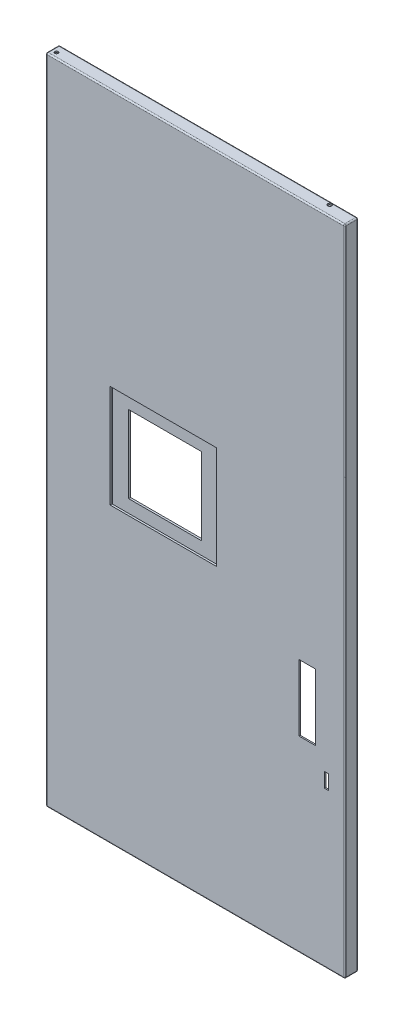
from build123d import *

# Parameters (mm, degrees)
SKETCH1_W                = 451
SKETCH1_H                = 20
BOSS_EXTRUDE1_DEPTH      = 666
SKETCH2_W                = 429
SKETCH2_H                = 644
CUT_EXTRUDE1_DEPTH       = 18
SKETCH3_W                = 429
SKETCH3_H                = 16
CUT_EXTRUDE2_DEPTH       = 9
SKETCH4_W                = 16
SKETCH4_H                = 653
CUT_EXTRUDE3_DEPTH       = 9
SKETCH5_W                = 438
SKETCH5_H                = 16
CUT_EXTRUDE4_DEPTH       = 9
SKETCH6_W                = 16
SKETCH6_H                = 662
CUT_EXTRUDE5_DEPTH       = 9
FILLET1_R                = 2
FILLET2_R                = 2
FILLET3_R                = 2
FILLET4_R                = 2
SKETCH16_R               = 3
CUT_EXTRUDE15_DEPTH      = 2
SKETCH23_W               = 451
SKETCH23_H               = 20
BOSS_EXTRUDE5_DEPTH      = 330
SKETCH25_W               = 429
SKETCH25_H               = 319
CUT_EXTRUDE19_DEPTH      = 18
SKETCH26_W               = 16
SKETCH26_H               = 319
CUT_EXTRUDE20_DEPTH      = 9
SKETCH27_W               = 438
SKETCH27_H               = 16
CUT_EXTRUDE21_DEPTH      = 9
SKETCH28_W               = 16
SKETCH28_H               = 328
CUT_EXTRUDE22_DEPTH      = 9
FILLET5_R                = 2
CUT_EXTRUDE24_DEPTH      = 1011.532161784
CUT_EXTRUDE24_DEPTH_BACK = 1011.532161784
SKETCH30_R               = 2.5
SKETCH31_R               = 3
CUT_EXTRUDE25_DEPTH      = 2
SKETCH29_R               = 3
CUT_EXTRUDE26_DEPTH      = 2
SKETCH32_W               = 25
SKETCH32_H               = 100
SKETCH32_W_2             = 6
SKETCH32_H_2             = 22
CUT_EXTRUDE27_DEPTH      = 2
SKETCH34_W               = 166
SKETCH34_H               = 276
BOSS_EXTRUDE6_DEPTH      = 6
CUT_EXTRUDE28_DEPTH      = 3
SKETCH35_R               = 4
CUT_EXTRUDE29_DEPTH      = 1011.625672542
SKETCH36_W               = 110
SKETCH36_H               = 232.68198512
CUT_EXTRUDE30_DEPTH      = 1011.625672542
SKETCH37_W               = 242.184541093
SKETCH37_H               = 239.855843582
SKETCH37_W_2             = 227.10839581
SKETCH37_H_2             = 174.911365708
BOSS_EXTRUDE7_DEPTH      = 2
SKETCH39_W               = 167.145869321
SKETCH39_H               = 47.919826933
SKETCH39_W_2             = 171.802191228
SKETCH39_H_2             = 78.040994734
CUT_EXTRUDE31_DEPTH      = 4
FILLET6_R                = 0.5
SKETCH40_W               = 166
SKETCH40_H               = 0.2
BOSS_EXTRUDE8_DEPTH      = 6
SKETCH41_W               = 110
SKETCH41_H               = 19.3
BOSS_EXTRUDE10_DEPTH     = 3


with BuildPart() as part:
    # Sketch1 → Boss-Extrude1 (new body)
    with BuildSketch(Plane(origin=(0, 0, 0), x_dir=(1, 0, 0), z_dir=(0, 1, 0))):
        Rectangle(SKETCH1_W, SKETCH1_H)
    extrude(amount=BOSS_EXTRUDE1_DEPTH)

    # Sketch2 → Cut-Extrude1 (cut)
    with BuildSketch(Plane(origin=(0, 0, -10), x_dir=(-1, 0, 0), z_dir=(0, 0, -1))):
        with Locations((0, 333)):
            Rectangle(SKETCH2_W, SKETCH2_H)
    extrude(amount=-CUT_EXTRUDE1_DEPTH, mode=Mode.SUBTRACT)

    # Sketch3 → Cut-Extrude2 (cut)
    with BuildSketch(Plane.XZ.offset(-655)):
        Rectangle(SKETCH3_W, SKETCH3_H)
    extrude(amount=-CUT_EXTRUDE2_DEPTH, mode=Mode.SUBTRACT)

    # Sketch4 → Cut-Extrude3 (cut)
    with BuildSketch(Plane.ZY.offset(-214.5)):
        with Locations((0, 337.5)):
            Rectangle(SKETCH4_W, SKETCH4_H)
    extrude(amount=-CUT_EXTRUDE3_DEPTH, mode=Mode.SUBTRACT)

    # Sketch5 → Cut-Extrude4 (cut)
    with BuildSketch(Plane(origin=(0, 11, 0), x_dir=(1, 0, 0), z_dir=(0, 1, 0))):
        with Locations((4.5, 0)):
            Rectangle(SKETCH5_W, SKETCH5_H)
    extrude(amount=-CUT_EXTRUDE4_DEPTH, mode=Mode.SUBTRACT)

    # Sketch6 → Cut-Extrude5 (cut)
    with BuildSketch(Plane(origin=(-214.5, 0, 0), x_dir=(0, 0, -1), z_dir=(1, 0, 0))):
        with Locations((0, 333)):
            Rectangle(SKETCH6_W, SKETCH6_H)
    extrude(amount=-CUT_EXTRUDE5_DEPTH, mode=Mode.SUBTRACT)

    # Fillet1
    fillet1_edges = [part.edges().sort_by_distance(p)[0] for p in [
        (0, 666, 10),
        (0, 664, 8),
        (0, 0, 10),
        (0, 0, -10),
        (-223.5, 333, 8),
        (225.5, 333, 10),
        (-225.5, 333, 10),
        (-225.5, 333, -10),
        (225.5, 333, -10),
        (0, 666, -10),
    ]]
    fillet(fillet1_edges, radius=FILLET1_R)

    # Fillet2
    fillet2_edges = [part.edges().sort_by_distance(p)[0] for p in [
        (223.5, 332, 8),
        (223.5, 2, 0),
        (223.5, 664, -1),
        (1, 2, 8),
        (223.5, 663.414213562, 7.414213562),
        (-223.5, 2, -1),
        (-222.914213562, 2, 7.414213562),
    ]]
    fillet(fillet2_edges, radius=FILLET2_R)

    # Fillet3
    # the kernel refuses this fillet: 2 mm, written as the material it takes off along each edge
    with BuildSketch(Plane(origin=(-223.5, 664, 8), x_dir=(0, 1, 0), z_dir=(-1, 0, 0))) as fillet3_piece_1_section:
        Polygon((0, 0), (FILLET3_R, 0), (FILLET3_R, -FILLET3_R), (0, -FILLET3_R), align=None)
    fillet3_piece_1 = extrude(amount=FILLET3_R, mode=Mode.PRIVATE)
    fillet3_piece_1 = fillet3_piece_1 - Plane(origin=(-223.5, 664, 8), x_dir=(0, -0.7071067811865475, -0.7071067811865475), z_dir=(-1, 0, 0)) * Sphere(FILLET3_R, mode=Mode.PRIVATE)
    add(fillet3_piece_1, mode=Mode.SUBTRACT)
    with BuildSketch(Plane(origin=(-223.5, 2, 8), x_dir=(-1, 0, 0), z_dir=(0, -1, 0))) as fillet3_piece_2_section:
        Polygon((0, 0), (FILLET3_R, 0), (FILLET3_R, -FILLET3_R), (0, -FILLET3_R), align=None)
    fillet3_piece_2 = extrude(amount=FILLET3_R, mode=Mode.PRIVATE)
    fillet3_piece_2 = fillet3_piece_2 - Plane(origin=(-223.5, 2, 8), x_dir=(0.7071067811865475, 0, -0.7071067811865475), z_dir=(0, -1, 0)) * Sphere(FILLET3_R, mode=Mode.PRIVATE)
    add(fillet3_piece_2, mode=Mode.SUBTRACT)
    with BuildSketch(Plane(origin=(223.5, 664, 8), x_dir=(0, 1, 0), z_dir=(1, 0, 0))) as fillet3_piece_3_section:
        Polygon((0, 0), (FILLET3_R, 0), (FILLET3_R, FILLET3_R), (0, FILLET3_R), align=None)
    fillet3_piece_3 = extrude(amount=FILLET3_R, mode=Mode.PRIVATE)
    fillet3_piece_3 = fillet3_piece_3 - Plane(origin=(223.5, 664, 8), x_dir=(0, -0.7071067811865475, -0.7071067811865475), z_dir=(1, 0, 0)) * Sphere(FILLET3_R, mode=Mode.PRIVATE)
    add(fillet3_piece_3, mode=Mode.SUBTRACT)
    with BuildSketch(Plane(origin=(223.5, 2, 8), x_dir=(1, 0, 0), z_dir=(0, -1, 0))) as fillet3_piece_4_section:
        Polygon((0, 0), (FILLET3_R, 0), (FILLET3_R, FILLET3_R), (0, FILLET3_R), align=None)
    fillet3_piece_4 = extrude(amount=FILLET3_R, mode=Mode.PRIVATE)
    fillet3_piece_4 = fillet3_piece_4 - Plane(origin=(223.5, 2, 8), x_dir=(-0.707106781186547, 0, -0.707106781186548), z_dir=(0, -1, 0)) * Sphere(FILLET3_R, mode=Mode.PRIVATE)
    add(fillet3_piece_4, mode=Mode.SUBTRACT)
    with BuildSketch(Plane(origin=(223.5, 2, -8), x_dir=(1, 0, 0), z_dir=(0, -1, 0))) as fillet3_piece_5_section:
        Polygon((0, 0), (FILLET3_R, 0), (FILLET3_R, -FILLET3_R), (0, -FILLET3_R), align=None)
    fillet3_piece_5 = extrude(amount=FILLET3_R, mode=Mode.PRIVATE)
    fillet3_piece_5 = fillet3_piece_5 - Plane(origin=(223.5, 2, -8), x_dir=(-0.707106781186548, 0, 0.707106781186547), z_dir=(0, -1, 0)) * Sphere(FILLET3_R, mode=Mode.PRIVATE)
    add(fillet3_piece_5, mode=Mode.SUBTRACT)
    with BuildSketch(Plane(origin=(-223.5, 2, -8), x_dir=(-1, 0, 0), z_dir=(0, -1, 0))) as fillet3_piece_6_section:
        Polygon((0, 0), (FILLET3_R, 0), (FILLET3_R, FILLET3_R), (0, FILLET3_R), align=None)
    fillet3_piece_6 = extrude(amount=FILLET3_R, mode=Mode.PRIVATE)
    fillet3_piece_6 = fillet3_piece_6 - Plane(origin=(-223.5, 2, -8), x_dir=(0.7071067811865475, 0, 0.7071067811865475), z_dir=(0, -1, 0)) * Sphere(FILLET3_R, mode=Mode.PRIVATE)
    add(fillet3_piece_6, mode=Mode.SUBTRACT)
    with BuildSketch(Plane(origin=(223.5, 664, -8), x_dir=(0, 1, 0), z_dir=(1, 0, 0))) as fillet3_piece_7_section:
        Polygon((0, 0), (FILLET3_R, 0), (FILLET3_R, -FILLET3_R), (0, -FILLET3_R), align=None)
    fillet3_piece_7 = extrude(amount=FILLET3_R, mode=Mode.PRIVATE)
    fillet3_piece_7 = fillet3_piece_7 - Plane(origin=(223.5, 664, -8), x_dir=(0, -0.7071067811865475, 0.7071067811865475), z_dir=(1, 0, 0)) * Sphere(FILLET3_R, mode=Mode.PRIVATE)
    add(fillet3_piece_7, mode=Mode.SUBTRACT)
    with BuildSketch(Plane(origin=(-223.5, 664, -8), x_dir=(0, 1, 0), z_dir=(-1, 0, 0))) as fillet3_piece_8_section:
        Polygon((0, 0), (FILLET3_R, 0), (FILLET3_R, FILLET3_R), (0, FILLET3_R), align=None)
    fillet3_piece_8 = extrude(amount=FILLET3_R, mode=Mode.PRIVATE)
    fillet3_piece_8 = fillet3_piece_8 - Plane(origin=(-223.5, 664, -8), x_dir=(0, -0.7071067811865475, 0.7071067811865475), z_dir=(-1, 0, 0)) * Sphere(FILLET3_R, mode=Mode.PRIVATE)
    add(fillet3_piece_8, mode=Mode.SUBTRACT)
    with BuildSketch(Plane(origin=(-225.5, 0, 8), x_dir=(1, 0, 0), z_dir=(0, 0, -1)), Plane(origin=(225.5, 0, -8), x_dir=(-1, 0, 0), z_dir=(0, 0, 1)), Plane(origin=(225.5, 666, -8), x_dir=(0, -1, 0), z_dir=(0, 0, 1)), Plane(origin=(-225.5, 666, 8), x_dir=(0, -1, 0), z_dir=(0, 0, -1))) as fillet3_piece_9:
        with BuildLine():
            CenterArc((FILLET3_R, -FILLET3_R), FILLET3_R, 90, 90)
            Line((0, -FILLET3_R), (0, 0))
            Line((0, 0), (FILLET3_R, 0))
        make_face()
    extrude(amount=16, mode=Mode.SUBTRACT)

    # Fillet4
    # the kernel refuses this fillet: 2 mm, written as the material it adds along each edge
    with BuildSketch(Plane(origin=(-221.5, 662, 6), x_dir=(-1, 0, 0), z_dir=(0, 1, 0))) as fillet4_piece_1_section:
        Polygon((0, 0), (FILLET4_R, 0), (FILLET4_R, FILLET4_R), (0, FILLET4_R), align=None)
    fillet4_piece_1 = extrude(amount=FILLET4_R, mode=Mode.PRIVATE)
    fillet4_piece_1 = fillet4_piece_1 - Plane(origin=(-221.5, 662, 6), x_dir=(0.7071067811865475, 0, -0.7071067811865475), z_dir=(0, 1, 0)) * Sphere(FILLET4_R, mode=Mode.PRIVATE)
    add(fillet4_piece_1)
    with BuildSketch(Plane(origin=(-223.5, 664, -8), x_dir=(1, 0, 0), z_dir=(0, 0, 1))) as fillet4_piece_2:
        with BuildLine():
            CenterArc((FILLET4_R, -FILLET4_R), FILLET4_R, 90, 90)
            Line((0, -FILLET4_R), (0, 0))
            Line((0, 0), (FILLET4_R, 0))
        make_face()
    extrude(amount=14)

    # Sketch16 → Cut-Extrude15 (cut)
    with BuildSketch(Plane(origin=(0, 666, 0), x_dir=(1, 0, 0), z_dir=(0, 1, 0))):
        with Locations(Location((-187.5, 5, 0), (0, 0, 90))):
            Circle(SKETCH16_R)
    extrude(amount=-CUT_EXTRUDE15_DEPTH, mode=Mode.SUBTRACT)

    # Sketch23 → Boss-Extrude5 (add)
    with BuildSketch(Plane.XZ.offset(-655)):
        Rectangle(SKETCH23_W, SKETCH23_H)
    extrude(amount=-BOSS_EXTRUDE5_DEPTH)

    # Sketch25 → Cut-Extrude19 (cut)
    with BuildSketch(Plane(origin=(0, 0, -10), x_dir=(-1, 0, 0), z_dir=(0, 0, -1))):
        with Locations((0, 814.5)):
            Rectangle(SKETCH25_W, SKETCH25_H)
    extrude(amount=-CUT_EXTRUDE19_DEPTH, mode=Mode.SUBTRACT)

    # Sketch26 → Cut-Extrude20 (cut)
    with BuildSketch(Plane(origin=(-214.5, 0, 0), x_dir=(0, 0, -1), z_dir=(1, 0, 0))):
        with Locations((0, 814.5)):
            Rectangle(SKETCH26_W, SKETCH26_H)
    extrude(amount=-CUT_EXTRUDE20_DEPTH, mode=Mode.SUBTRACT)

    # Sketch27 → Cut-Extrude21 (cut)
    with BuildSketch(Plane.XZ.offset(-974)):
        with Locations((-4.5, 0)):
            Rectangle(SKETCH27_W, SKETCH27_H)
    extrude(amount=-CUT_EXTRUDE21_DEPTH, mode=Mode.SUBTRACT)

    # Sketch28 → Cut-Extrude22 (cut)
    with BuildSketch(Plane.ZY.offset(-214.5)):
        with Locations((0, 819)):
            Rectangle(SKETCH28_W, SKETCH28_H)
    extrude(amount=-CUT_EXTRUDE22_DEPTH, mode=Mode.SUBTRACT)

    # Fillet5
    fillet5_edges = [part.edges().sort_by_distance(p)[0] for p in [
        (223.5, 819, 8),
        (-223.5, 819, 8),
        (-225.5, 820, 10),
        (-225.5, 820, -10),
        (-225.5, 985, 0),
        (0, 985, -10),
        (225.5, 985, 0),
        (0, 985, 10),
        (225.5, 820, 10),
        (225.5, 820, -10),
    ]]
    fillet(fillet5_edges, radius=FILLET5_R)

    # Sketch30 → Cut-Extrude24 (cut, two sides: drawn at the far end of the back side and taken through both)
    with BuildSketch(Plane(origin=(0, 985, 0), x_dir=(1, 0, 0), z_dir=(0, 1, 0)).offset(-CUT_EXTRUDE24_DEPTH_BACK)):
        with Locations(Location((-217.5, -2, 0), (0, 0, 90))):
            Circle(SKETCH30_R)
    extrude(amount=CUT_EXTRUDE24_DEPTH + CUT_EXTRUDE24_DEPTH_BACK, mode=Mode.SUBTRACT)

    # Sketch31 → Cut-Extrude25 (cut)
    with BuildSketch(Plane(origin=(0, 985, 0), x_dir=(1, 0, 0), z_dir=(0, 1, 0))):
        with Locations(Location((187.5, 5, 0), (0, 0, 90))):
            Circle(SKETCH31_R)
    extrude(amount=-CUT_EXTRUDE25_DEPTH, mode=Mode.SUBTRACT)

    # Sketch29 → Cut-Extrude26 (cut)
    with BuildSketch(Plane.XZ):
        with Locations(Location((150.5, -5, 0), (0, 0, 270))):
            Circle(SKETCH29_R)
    extrude(amount=-CUT_EXTRUDE26_DEPTH, mode=Mode.SUBTRACT)

    # Sketch32 → Cut-Extrude27 (cut)
    with BuildSketch(Plane.XY.offset(10)):
        with Locations((169, 333)):
            Rectangle(SKETCH32_W, SKETCH32_H)
        with Locations((198, 245)):
            Rectangle(SKETCH32_W_2, SKETCH32_H_2)
    extrude(amount=-CUT_EXTRUDE27_DEPTH, mode=Mode.SUBTRACT)

    # Sketch34 → Boss-Extrude6 (add)
    with BuildSketch(Plane.XY.offset(10)):
        with Locations((-48.5, 506)):
            Rectangle(SKETCH34_W, SKETCH34_H)
    extrude(amount=-BOSS_EXTRUDE6_DEPTH)

    # Sketch33 → Cut-Extrude28 (cut)
    with BuildSketch(Plane.XY.offset(10)):
        with BuildLine():
            Line((-125.5, 641), (28.5, 641))
            ThreePointArc((28.5, 641), (30.621320344, 640.121320344), (31.5, 638))
            Line((31.5, 638), (31.5, 374))
            ThreePointArc((31.5, 374), (30.621320344, 371.878679656), (28.5, 371))
            Line((28.5, 371), (-125.5, 371))
            ThreePointArc((-125.5, 371), (-127.621320344, 371.878679656), (-128.5, 374))
            Line((-128.5, 374), (-128.5, 638))
            ThreePointArc((-128.5, 638), (-127.621320344, 640.121320344), (-125.5, 641))
        make_face()
    extrude(amount=-CUT_EXTRUDE28_DEPTH, mode=Mode.SUBTRACT)

    # Sketch35 → Cut-Extrude29 (cut, through all)
    with BuildSketch(Plane.XY.offset(7)):
        with Locations((19.5, 629)):
            Circle(SKETCH35_R)
        with Locations((-116.5, 383)):
            Circle(SKETCH35_R)
        with Locations((-116.5, 629)):
            Circle(SKETCH35_R)
        with Locations((19.5, 383)):
            Circle(SKETCH35_R)
    extrude(amount=-CUT_EXTRUDE29_DEPTH, mode=Mode.SUBTRACT)

    # Sketch36 → Cut-Extrude30 (cut, through all)
    with BuildSketch(Plane.XY.offset(7)):
        with Locations((-48.5, 507.15900744)):
            Rectangle(SKETCH36_W, SKETCH36_H)
    extrude(amount=-CUT_EXTRUDE30_DEPTH, mode=Mode.SUBTRACT)

    # Sketch37 → Boss-Extrude7 (add)
    with BuildSketch(Plane.XY.offset(10)):
        with Locations((-51.876307083, 717.267921791)):
            Rectangle(SKETCH37_W, SKETCH37_H)
        with Locations((-44.338234442, 354.856302266)):
            Rectangle(SKETCH37_W_2, SKETCH37_H_2)
    extrude(amount=-BOSS_EXTRUDE7_DEPTH)

    # Sketch39 → Cut-Extrude31 (cut)
    with BuildSketch(Plane(origin=(0, 0, 4), x_dir=(-1, 0, 0), z_dir=(0, 0, -1))):
        with Locations((49.072934661, 621.299913467)):
            Rectangle(SKETCH39_W, SKETCH39_H)
        with Locations((47.429752922, 403.291487753)):
            Rectangle(SKETCH39_W_2, SKETCH39_H_2)
    extrude(amount=-CUT_EXTRUDE31_DEPTH, mode=Mode.SUBTRACT)

    # Fillet6
    fillet6_edges = [part.edges().sort_by_distance(p)[0] for p in [
        (31.5, 519.82599256, 7),
        (-128.5, 519.82599256, 7),
    ]]
    fillet(fillet6_edges, radius=FILLET6_R)

    # Sketch40 → Boss-Extrude8 (add)
    with BuildSketch(Plane(origin=(0, 0, 4), x_dir=(-1, 0, 0), z_dir=(0, 0, -1))):
        with Locations((48.5, 597.44)):
            Rectangle(SKETCH40_W, SKETCH40_H)
        with Locations((48.5, 442.21198512)):
            Rectangle(SKETCH40_W, SKETCH40_H)
    extrude(amount=-BOSS_EXTRUDE8_DEPTH)

    # Sketch41 → Boss-Extrude10 (add)
    with BuildSketch(Plane(origin=(0, 0, 4), x_dir=(-1, 0, 0), z_dir=(0, 0, -1))):
        with Locations((48.5, 587.69)):
            Rectangle(SKETCH41_W, SKETCH41_H)
        with Locations((48.5, 451.96198512)):
            Rectangle(SKETCH41_W, SKETCH41_H)
    extrude(amount=-BOSS_EXTRUDE10_DEPTH)


solid = part.part
